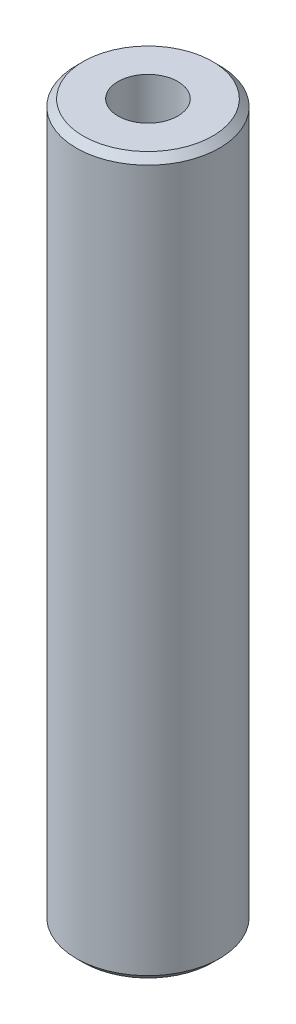
from build123d import *

# Parameters (mm, degrees)
SKETCH1_R           = 60
BOSS_EXTRUDE1_DEPTH = 600
SKETCH2_R           = 25.095939283
CUT_EXTRUDE1_DEPTH  = 606.970296302
CHAMFER1_SIZE       = 5.810319736


with BuildPart() as part:
    # Sketch1 → Boss-Extrude1 (new body)
    with BuildSketch(Plane(origin=(0, 0, 0), x_dir=(1, 0, 0), z_dir=(0, 1, 0))):
        Circle(SKETCH1_R)
    extrude(amount=BOSS_EXTRUDE1_DEPTH)

    # Sketch2 → Cut-Extrude1 (cut, through all)
    with BuildSketch(Plane(origin=(0, 0, 0), x_dir=(1, 0, 0), z_dir=(0, 1, 0))):
        Circle(SKETCH2_R)
    extrude(amount=CUT_EXTRUDE1_DEPTH, mode=Mode.SUBTRACT)

    # Chamfer1
    chamfer1_edges = [part.edges().sort_by_distance(p)[0] for p in [
        (-60, 600, 0),
        (-60, 0, 0),
    ]]
    chamfer(chamfer1_edges, length=CHAMFER1_SIZE)


solid = part.part
